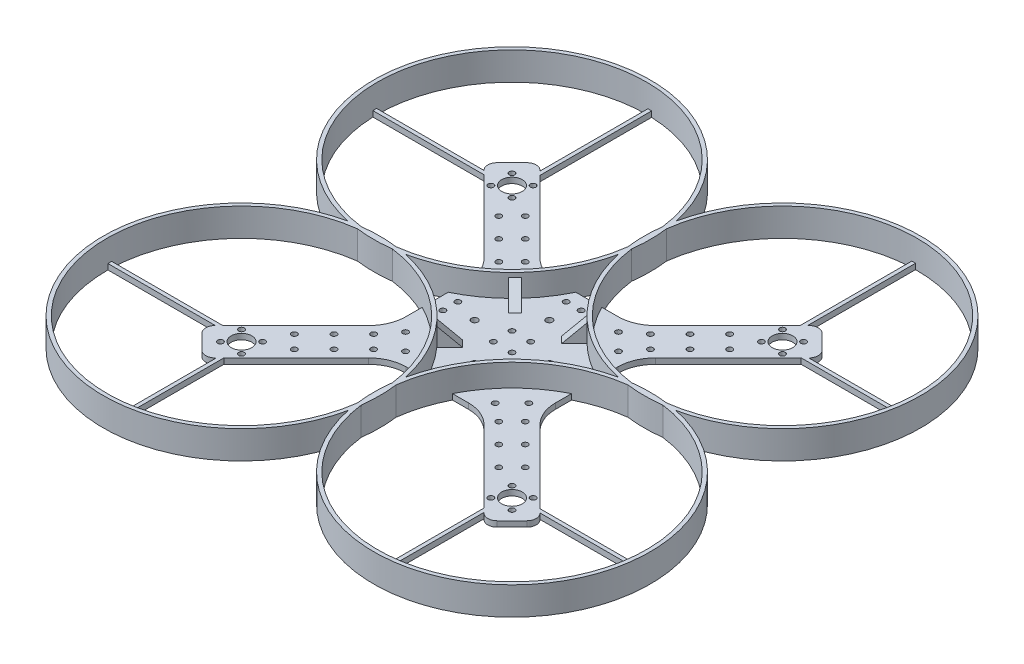
from build123d import *
from build123d.topology import SkipClean

# Parameters (mm, degrees)
BOSS_EXTRUDE1_DEPTH                          = 3
SKETCH2_R                                    = 5.5
CUT_EXTRUDE1_DEPTH                           = 126.093373509
SKETCH3_R                                    = 1.5
CUT_EXTRUDE2_DEPTH                           = 126.093373509
SKETCH4_R                                    = 74
SKETCH4_R_2                                  = 72
BOSS_EXTRUDE2_DEPTH                          = 15
SKETCH6_R                                    = 1.5
SKETCH6_R_2                                  = 1.75
CUT_EXTRUDE3_DEPTH                           = 208.379010802
SKETCH7_R                                    = 1.5
CUT_EXTRUDE4_DEPTH                           = 208.379010802
LPATTERN1_COUNT                              = 3
LPATTERN1_PITCH                              = 15
BOSS_EXTRUDE3_DEPTH                          = 10
SKETCH9_W                                    = 2
SKETCH9_H                                    = 62.719662137
SKETCH9_W_2                                  = 62.602149485
SKETCH9_H_2                                  = 2
BOSS_EXTRUDE4_DEPTH                          = 3
MIRROR2_COPY_1_SKETCH_R                      = 1.5
MIRROR2_COPY_1_DEPTH                         = 208.379010802
MIRROR2_COPY_2_SKETCH_R                      = 1.5
MIRROR2_COPY_2_DEPTH                         = 208.379010802
MIRROR2_AT_THE_SECOND_PLANE_COPY_1_SKETC_R   = 1.5
MIRROR2_AT_THE_SECOND_PLANE_COPY_1_DEPTH     = 208.379010802
MIRROR2_AT_THE_SECOND_PLANE_COPY_2_SKETC_R   = 1.5
MIRROR2_AT_THE_SECOND_PLANE_COPY_2_DEPTH     = 208.379010802
MIRROR2_AT_THE_SECOND_PLANE_COPY_3_DEPTH     = 3
MIRROR2_AT_THE_SECOND_PLANE_COPY_4_SKETC_R   = 5.5
MIRROR2_AT_THE_SECOND_PLANE_COPY_4_DEPTH     = 126.093373509
MIRROR2_AT_THE_SECOND_PLANE_COPY_5_SKETC_R   = 1.5
MIRROR2_AT_THE_SECOND_PLANE_COPY_5_DEPTH     = 126.093373509
MIRROR2_AT_THE_SECOND_PLANE_COPY_6_SKETC_R   = 74
MIRROR2_AT_THE_SECOND_PLANE_COPY_6_SKETC_R_2 = 72
MIRROR2_AT_THE_SECOND_PLANE_COPY_6_DEPTH     = 15
MIRROR2_AT_THE_SECOND_PLANE_COPY_7_SKETC_R   = 1.5
MIRROR2_AT_THE_SECOND_PLANE_COPY_7_SKETC_R_2 = 1.75
MIRROR2_AT_THE_SECOND_PLANE_COPY_7_DEPTH     = 208.379010802
MIRROR2_AT_THE_SECOND_PLANE_COPY_8_SKETC_R   = 1.5
MIRROR2_AT_THE_SECOND_PLANE_COPY_8_DEPTH     = 208.379010802
MIRROR2_AT_THE_SECOND_PLANE_COPY_9_DEPTH     = 10
MIRROR2_AT_THE_SECOND_PLANE_COPY_10_SKET_W   = 2
MIRROR2_AT_THE_SECOND_PLANE_COPY_10_SKET_H   = 62.719662137
MIRROR2_AT_THE_SECOND_PLANE_COPY_10_SKET_W_2 = 62.602149485
MIRROR2_AT_THE_SECOND_PLANE_COPY_10_SKET_H_2 = 2
MIRROR2_AT_THE_SECOND_PLANE_COPY_10_DEPTH    = 3
MIRROR2_AT_THE_SECOND_PLANE_COPY_11_SKET_R   = 1.5
MIRROR2_AT_THE_SECOND_PLANE_COPY_11_DEPTH    = 208.379010802
MIRROR2_AT_THE_SECOND_PLANE_COPY_12_SKET_R   = 1.5
MIRROR2_AT_THE_SECOND_PLANE_COPY_12_DEPTH    = 208.379010802
CHAMFER1_SIZE                                = 10


with BuildPart() as part:
    # Sketch1 → Boss-Extrude1 (new body)
    with BuildSketch(Plane(origin=(0, 0, 0), x_dir=(1, 0, 0), z_dir=(0, 1, 0))):
        with BuildLine():
            Line((30.857864376, 45.857864376), (71.964466094, 86.964466094))
            ThreePointArc((71.964466094, 86.964466094), (75.5, 88.428932188), (79.035533906, 86.964466094))
            Line((79.035533906, 86.964466094), (86.964466094, 79.035533906))
            ThreePointArc((86.964466094, 79.035533906), (88.428932188, 75.5), (86.964466094, 71.964466094))
            Line((86.964466094, 71.964466094), (45.857864376, 30.857864376))
            ThreePointArc((45.857864376, 30.857864376), (41.52240935, 24.3693974), (40, 16.715728753))
            Line((40, 16.715728753), (40, 0))
            Line((40, 0), (0, 0))
            Line((0, 0), (0, 40))
            Line((0, 40), (16.715728753, 40))
            ThreePointArc((16.715728753, 40), (24.3693974, 41.52240935), (30.857864376, 45.857864376))
        make_face()
    boss_extrude1 = extrude(amount=BOSS_EXTRUDE1_DEPTH)

    # Sketch2 → Cut-Extrude1 (cut, through all)
    with BuildSketch(Plane(origin=(0, 3, 0), x_dir=(1, 0, 0), z_dir=(0, 1, 0))):
        with Locations(Location((72.393398282, 72.393398282, 0), (0, 0, 270))):
            Circle(SKETCH2_R)
    cut_extrude1 = extrude(amount=-CUT_EXTRUDE1_DEPTH, mode=Mode.SUBTRACT)

    # Sketch3 → Cut-Extrude2 (cut, through all)
    with BuildSketch(Plane(origin=(0, 3, 0), x_dir=(1, 0, 0), z_dir=(0, 1, 0))):
        with Locations(Location((66.736544033, 78.050252532, 0), (0, 0, 270))):
            Circle(SKETCH3_R)
        with Locations(Location((66.736544033, 66.736544033, 0), (0, 0, 270))):
            Circle(SKETCH3_R)
        with Locations(Location((78.050252532, 66.736544033, 0), (0, 0, 270))):
            Circle(SKETCH3_R)
        with Locations(Location((78.050252532, 78.050252532, 0), (0, 0, 270))):
            Circle(SKETCH3_R)
    cut_extrude2 = extrude(amount=-CUT_EXTRUDE2_DEPTH, mode=Mode.SUBTRACT)

    # Sketch4 → Boss-Extrude2 (add)
    with BuildSketch(Plane(origin=(0, 0, 0), x_dir=(1, 0, 0), z_dir=(0, 1, 0))):
        with Locations(Location((72.393398282, 72.393398282, 0), (0, 0, 205.960322583))):
            Circle(SKETCH4_R)
        with Locations(Location((72.393398282, 72.393398282, 0), (0, 0, 206.737801334))):
            Circle(SKETCH4_R_2, mode=Mode.SUBTRACT)
    boss_extrude2 = extrude(amount=BOSS_EXTRUDE2_DEPTH)

    # Sketch6 → Cut-Extrude3 (cut, through all)
    with BuildSketch(Plane(origin=(0, 3, 0), x_dir=(1, 0, 0), z_dir=(0, 1, 0))):
        with Locations(Location((33, 24, 0), (0, 0, 270))):
            Circle(SKETCH6_R)
        with Locations(Location((24, 33, 0), (0, 0, 270))):
            Circle(SKETCH6_R)
        with Locations(Location((4, 33, 0), (0, 0, 270))):
            Circle(SKETCH6_R)
        with Locations(Location((33, 4, 0), (0, 0, 270))):
            Circle(SKETCH6_R)
        with Locations(Location((5, 5, 0), (0, 0, 270))):
            Circle(SKETCH6_R)
        with Locations((0, 20)):
            Circle(SKETCH6_R_2)
        with Locations((20, 0)):
            Circle(SKETCH6_R_2)
    cut_extrude3 = extrude(amount=-CUT_EXTRUDE3_DEPTH, mode=Mode.SUBTRACT)

    # Sketch7 → Cut-Extrude4 (cut, through all)
    with BuildSketch(Plane(origin=(0, 3, 0), x_dir=(1, 0, 0), z_dir=(0, 1, 0))):
        with Locations(Location((54.715728753, 61.786796564, 0), (0, 0, 270))):
            Circle(SKETCH7_R)
        with Locations(Location((61.786796564, 54.715728753, 0), (0, 0, 270))):
            Circle(SKETCH7_R)
    cut_extrude4 = extrude(amount=-CUT_EXTRUDE4_DEPTH, mode=Mode.SUBTRACT)

    # LPattern1: Cut-Extrude4 ×3
    with Locations(*[Vector(-0.707106781186546, 0, 0.707106781186549) * (i * LPATTERN1_PITCH) for i in range(1, LPATTERN1_COUNT)]):
        add(cut_extrude4, mode=Mode.SUBTRACT)

    # Sketch8 → Boss-Extrude3 (add)
    with BuildSketch(Plane(origin=(0, 3, 0), x_dir=(1, 0, 0), z_dir=(0, 1, 0))):
        Polygon((18.240443886, 23.420052459), (21.720624472, 19.939871873), (14.166877011, 12.386124412), (10.686696425, 15.866304998), align=None)
    boss_extrude3 = extrude(amount=BOSS_EXTRUDE3_DEPTH)

    # Sketch9 → Boss-Extrude4 (add)
    with BuildSketch(Plane(origin=(0, 0, 0), x_dir=(1, 0, 0), z_dir=(0, 1, 0))):
        with Locations((70.619821935, 113.693479817)):
            Rectangle(SKETCH9_W, SKETCH9_H)
        with Locations((113.743421737, 70.901552947)):
            Rectangle(SKETCH9_W_2, SKETCH9_H_2)
    boss_extrude4 = extrude(amount=BOSS_EXTRUDE4_DEPTH)

    # Mirror2: Boss-Extrude1, Cut-Extrude1, Cut-Extrude2, Boss-Extrude2, Cut-Extrude3, Cut-Extrude4, Boss-Extrude3, Boss-Extrude4 across plane
    with SkipClean():  # the faces are left unmerged after this step: merging them gives an invalid solid
        add(boss_extrude1.mirror(Plane(origin=(0, 0, 0), x_dir=(0, 0, 1), z_dir=(1, 0, 0))))
        add(cut_extrude1.mirror(Plane(origin=(0, 0, 0), x_dir=(0, 0, 1), z_dir=(1, 0, 0))), mode=Mode.SUBTRACT)
        add(cut_extrude2.mirror(Plane(origin=(0, 0, 0), x_dir=(0, 0, 1), z_dir=(1, 0, 0))), mode=Mode.SUBTRACT)
        add(boss_extrude2.mirror(Plane(origin=(0, 0, 0), x_dir=(0, 0, 1), z_dir=(1, 0, 0))))
        add(cut_extrude3.mirror(Plane(origin=(0, 0, 0), x_dir=(0, 0, 1), z_dir=(1, 0, 0))), mode=Mode.SUBTRACT)
        add(cut_extrude4.mirror(Plane(origin=(0, 0, 0), x_dir=(0, 0, 1), z_dir=(1, 0, 0))), mode=Mode.SUBTRACT)
        add(boss_extrude3.mirror(Plane(origin=(0, 0, 0), x_dir=(0, 0, 1), z_dir=(1, 0, 0))))
        add(boss_extrude4.mirror(Plane(origin=(0, 0, 0), x_dir=(0, 0, 1), z_dir=(1, 0, 0))))
    add(part.part.scale(1), mode=Mode.REPLACE)  # the faces are merged on a copy

    # Mirror2 copy 1 sketch → Mirror2 copy 1 (cut, through all)
    with BuildSketch(Plane(origin=(10.606601718, 3, 10.606601718), x_dir=(-1, 0, 0), z_dir=(0, 1, 0))):
        with Locations((54.715728753, -61.786796564)):
            Circle(MIRROR2_COPY_1_SKETCH_R)
        with Locations((61.786796564, -54.715728753)):
            Circle(MIRROR2_COPY_1_SKETCH_R)
    extrude(amount=-MIRROR2_COPY_1_DEPTH, mode=Mode.SUBTRACT)

    # Mirror2 copy 2 sketch → Mirror2 copy 2 (cut, through all)
    with BuildSketch(Plane(origin=(21.213203436, 3, 21.213203436), x_dir=(-1, 0, 0), z_dir=(0, 1, 0))):
        with Locations((54.715728753, -61.786796564)):
            Circle(MIRROR2_COPY_2_SKETCH_R)
        with Locations((61.786796564, -54.715728753)):
            Circle(MIRROR2_COPY_2_SKETCH_R)
    extrude(amount=-MIRROR2_COPY_2_DEPTH, mode=Mode.SUBTRACT)

    # Mirror2 at the second plane: Boss-Extrude1, Cut-Extrude1, Cut-Extrude2, Boss-Extrude2, Cut-Extrude3, Cut-Extrude4, Boss-Extrude3, Boss-Extrude4 across plane
    with SkipClean():  # the faces are left unmerged after this step: merging them gives an invalid solid
        add(boss_extrude1.mirror(Plane.XY))
        add(cut_extrude1.mirror(Plane.XY), mode=Mode.SUBTRACT)
        add(cut_extrude2.mirror(Plane.XY), mode=Mode.SUBTRACT)
        add(boss_extrude2.mirror(Plane.XY))
        add(cut_extrude3.mirror(Plane.XY), mode=Mode.SUBTRACT)
        add(cut_extrude4.mirror(Plane.XY), mode=Mode.SUBTRACT)
        add(boss_extrude3.mirror(Plane.XY))
        add(boss_extrude4.mirror(Plane.XY))
    add(part.part.scale(1), mode=Mode.REPLACE)  # the faces are merged on a copy

    # Mirror2 at the second plane copy 1 sketc → Mirror2 at the second plane copy 1 (cut, through all)
    with BuildSketch(Plane(origin=(-10.606601718, 3, -10.606601718), x_dir=(1, 0, 0), z_dir=(0, 1, 0))):
        with Locations((54.715728753, -61.786796564)):
            Circle(MIRROR2_AT_THE_SECOND_PLANE_COPY_1_SKETC_R)
        with Locations((61.786796564, -54.715728753)):
            Circle(MIRROR2_AT_THE_SECOND_PLANE_COPY_1_SKETC_R)
    extrude(amount=-MIRROR2_AT_THE_SECOND_PLANE_COPY_1_DEPTH, mode=Mode.SUBTRACT)

    # Mirror2 at the second plane copy 2 sketc → Mirror2 at the second plane copy 2 (cut, through all)
    with BuildSketch(Plane(origin=(-21.213203436, 3, -21.213203436), x_dir=(1, 0, 0), z_dir=(0, 1, 0))):
        with Locations((54.715728753, -61.786796564)):
            Circle(MIRROR2_AT_THE_SECOND_PLANE_COPY_2_SKETC_R)
        with Locations((61.786796564, -54.715728753)):
            Circle(MIRROR2_AT_THE_SECOND_PLANE_COPY_2_SKETC_R)
    extrude(amount=-MIRROR2_AT_THE_SECOND_PLANE_COPY_2_DEPTH, mode=Mode.SUBTRACT)

    # Mirror2 at the second plane copy 3 sketc → Mirror2 at the second plane copy 3 (add)
    with BuildSketch(Plane(origin=(0, 0, 0), x_dir=(-1, 0, 0), z_dir=(0, 1, 0))):
        with BuildLine():
            Line((30.857864376, 45.857864376), (71.964466094, 86.964466094))
            ThreePointArc((71.964466094, 86.964466094), (75.5, 88.428932188), (79.035533906, 86.964466094))
            Line((79.035533906, 86.964466094), (86.964466094, 79.035533906))
            ThreePointArc((86.964466094, 79.035533906), (88.428932188, 75.5), (86.964466094, 71.964466094))
            Line((86.964466094, 71.964466094), (45.857864376, 30.857864376))
            ThreePointArc((45.857864376, 30.857864376), (41.52240935, 24.3693974), (40, 16.715728753))
            Line((40, 16.715728753), (40, 0))
            Line((40, 0), (0, 0))
            Line((0, 0), (0, 40))
            Line((0, 40), (16.715728753, 40))
            ThreePointArc((16.715728753, 40), (24.3693974, 41.52240935), (30.857864376, 45.857864376))
        make_face()
    extrude(amount=MIRROR2_AT_THE_SECOND_PLANE_COPY_3_DEPTH)

    # Mirror2 at the second plane copy 4 sketc → Mirror2 at the second plane copy 4 (cut, through all)
    with BuildSketch(Plane(origin=(0, 3, 0), x_dir=(-1, 0, 0), z_dir=(0, 1, 0))):
        with Locations(Location((72.393398282, 72.393398282, 0), (0, 0, 270))):
            Circle(MIRROR2_AT_THE_SECOND_PLANE_COPY_4_SKETC_R)
    extrude(amount=-MIRROR2_AT_THE_SECOND_PLANE_COPY_4_DEPTH, mode=Mode.SUBTRACT)

    # Mirror2 at the second plane copy 5 sketc → Mirror2 at the second plane copy 5 (cut, through all)
    with BuildSketch(Plane(origin=(0, 3, 0), x_dir=(-1, 0, 0), z_dir=(0, 1, 0))):
        with Locations(Location((66.736544033, 78.050252532, 0), (0, 0, 270))):
            Circle(MIRROR2_AT_THE_SECOND_PLANE_COPY_5_SKETC_R)
        with Locations(Location((66.736544033, 66.736544033, 0), (0, 0, 270))):
            Circle(MIRROR2_AT_THE_SECOND_PLANE_COPY_5_SKETC_R)
        with Locations(Location((78.050252532, 66.736544033, 0), (0, 0, 270))):
            Circle(MIRROR2_AT_THE_SECOND_PLANE_COPY_5_SKETC_R)
        with Locations(Location((78.050252532, 78.050252532, 0), (0, 0, 270))):
            Circle(MIRROR2_AT_THE_SECOND_PLANE_COPY_5_SKETC_R)
    extrude(amount=-MIRROR2_AT_THE_SECOND_PLANE_COPY_5_DEPTH, mode=Mode.SUBTRACT)

    # Mirror2 at the second plane copy 6 sketc → Mirror2 at the second plane copy 6 (add)
    with SkipClean():  # the faces are left unmerged after this step: merging them gives an invalid solid
        with BuildSketch(Plane(origin=(0, 0, 0), x_dir=(-1, 0, 0), z_dir=(0, 1, 0))):
            with Locations(Location((72.393398282, 72.393398282, 0), (0, 0, 205.960322583))):
                Circle(MIRROR2_AT_THE_SECOND_PLANE_COPY_6_SKETC_R)
            with Locations(Location((72.393398282, 72.393398282, 0), (0, 0, 206.737801334))):
                Circle(MIRROR2_AT_THE_SECOND_PLANE_COPY_6_SKETC_R_2, mode=Mode.SUBTRACT)
        extrude(amount=MIRROR2_AT_THE_SECOND_PLANE_COPY_6_DEPTH)
    add(part.part.scale(1), mode=Mode.REPLACE)  # the faces are merged on a copy

    # Mirror2 at the second plane copy 7 sketc → Mirror2 at the second plane copy 7 (cut, through all)
    with SkipClean():  # the faces are left unmerged after this step: merging them gives an invalid solid
        with BuildSketch(Plane(origin=(0, 3, 0), x_dir=(-1, 0, 0), z_dir=(0, 1, 0))):
            with Locations(Location((33, 24, 0), (0, 0, 270))):
                Circle(MIRROR2_AT_THE_SECOND_PLANE_COPY_7_SKETC_R)
            with Locations(Location((24, 33, 0), (0, 0, 270))):
                Circle(MIRROR2_AT_THE_SECOND_PLANE_COPY_7_SKETC_R)
            with Locations(Location((4, 33, 0), (0, 0, 270))):
                Circle(MIRROR2_AT_THE_SECOND_PLANE_COPY_7_SKETC_R)
            with Locations(Location((33, 4, 0), (0, 0, 270))):
                Circle(MIRROR2_AT_THE_SECOND_PLANE_COPY_7_SKETC_R)
            with Locations(Location((5, 5, 0), (0, 0, 270))):
                Circle(MIRROR2_AT_THE_SECOND_PLANE_COPY_7_SKETC_R)
            with Locations((0, 20)):
                Circle(MIRROR2_AT_THE_SECOND_PLANE_COPY_7_SKETC_R_2)
            with Locations((20, 0)):
                Circle(MIRROR2_AT_THE_SECOND_PLANE_COPY_7_SKETC_R_2)
        extrude(amount=-MIRROR2_AT_THE_SECOND_PLANE_COPY_7_DEPTH, mode=Mode.SUBTRACT)

    # Mirror2 at the second plane copy 8 sketc → Mirror2 at the second plane copy 8 (cut, through all)
    with SkipClean():  # the faces are left unmerged after this step: merging them gives an invalid solid
        with BuildSketch(Plane(origin=(0, 3, 0), x_dir=(-1, 0, 0), z_dir=(0, 1, 0))):
            with Locations(Location((54.715728753, 61.786796564, 0), (0, 0, 270))):
                Circle(MIRROR2_AT_THE_SECOND_PLANE_COPY_8_SKETC_R)
            with Locations(Location((61.786796564, 54.715728753, 0), (0, 0, 270))):
                Circle(MIRROR2_AT_THE_SECOND_PLANE_COPY_8_SKETC_R)
        extrude(amount=-MIRROR2_AT_THE_SECOND_PLANE_COPY_8_DEPTH, mode=Mode.SUBTRACT)

    # Mirror2 at the second plane copy 9 sketc → Mirror2 at the second plane copy 9 (add)
    with SkipClean():  # the faces are left unmerged after this step: merging them gives an invalid solid
        with BuildSketch(Plane(origin=(0, 3, 0), x_dir=(-1, 0, 0), z_dir=(0, 1, 0))):
            Polygon((18.240443886, 23.420052459), (21.720624472, 19.939871873), (14.166877011, 12.386124412), (10.686696425, 15.866304998), align=None)
        extrude(amount=MIRROR2_AT_THE_SECOND_PLANE_COPY_9_DEPTH)

    # Mirror2 at the second plane copy 10 sket → Mirror2 at the second plane copy 10 (add)
    with SkipClean():  # the faces are left unmerged after this step: merging them gives an invalid solid
        with BuildSketch(Plane(origin=(0, 0, 0), x_dir=(-1, 0, 0), z_dir=(0, 1, 0))):
            with Locations((70.619821935, 113.693479817)):
                Rectangle(MIRROR2_AT_THE_SECOND_PLANE_COPY_10_SKET_W, MIRROR2_AT_THE_SECOND_PLANE_COPY_10_SKET_H)
            with Locations((113.743421737, 70.901552947)):
                Rectangle(MIRROR2_AT_THE_SECOND_PLANE_COPY_10_SKET_W_2, MIRROR2_AT_THE_SECOND_PLANE_COPY_10_SKET_H_2)
        extrude(amount=MIRROR2_AT_THE_SECOND_PLANE_COPY_10_DEPTH)

    # Mirror2 at the second plane copy 11 sket → Mirror2 at the second plane copy 11 (cut, through all)
    with SkipClean():  # the faces are left unmerged after this step: merging them gives an invalid solid
        with BuildSketch(Plane(origin=(10.606601718, 3, -10.606601718), x_dir=(-1, 0, 0), z_dir=(0, 1, 0))):
            with Locations(Location((54.715728753, 61.786796564, 0), (0, 0, 270))):
                Circle(MIRROR2_AT_THE_SECOND_PLANE_COPY_11_SKET_R)
            with Locations(Location((61.786796564, 54.715728753, 0), (0, 0, 270))):
                Circle(MIRROR2_AT_THE_SECOND_PLANE_COPY_11_SKET_R)
        extrude(amount=-MIRROR2_AT_THE_SECOND_PLANE_COPY_11_DEPTH, mode=Mode.SUBTRACT)

    # Mirror2 at the second plane copy 12 sket → Mirror2 at the second plane copy 12 (cut, through all)
    with SkipClean():  # the faces are left unmerged after this step: merging them gives an invalid solid
        with BuildSketch(Plane(origin=(21.213203436, 3, -21.213203436), x_dir=(-1, 0, 0), z_dir=(0, 1, 0))):
            with Locations(Location((54.715728753, 61.786796564, 0), (0, 0, 270))):
                Circle(MIRROR2_AT_THE_SECOND_PLANE_COPY_12_SKET_R)
            with Locations(Location((61.786796564, 54.715728753, 0), (0, 0, 270))):
                Circle(MIRROR2_AT_THE_SECOND_PLANE_COPY_12_SKET_R)
        extrude(amount=-MIRROR2_AT_THE_SECOND_PLANE_COPY_12_DEPTH, mode=Mode.SUBTRACT)

    # Chamfer1
    # the kernel refuses this chamfer: 10 mm, written as the material it takes off along each edge
    with BuildSketch(Plane(origin=(32.35142181, 13, 5.798420387), x_dir=(0.7068394360706738, 0.027495876610586313, -0.7068394360706733), z_dir=(-0.7071067811865474, 0, -0.7071067811865477))) as chamfer1_piece_1_section:
        Polygon((CHAMFER1_SIZE * 0.999621916911, CHAMFER1_SIZE * 0.0274958766106), (-CHAMFER1_SIZE * 0.0274958766106, CHAMFER1_SIZE * 0.999621916911), (0, 0), align=None)
    chamfer1_piece_1 = extrude(amount=56.355378344, mode=Mode.PRIVATE)
    chamfer1_piece_1 = chamfer1_piece_1 - Plane(origin=(72.393398282, 9.709058725, -72.393398282), x_dir=(-0.8990974034681367, 0, 0.43774862544256443), z_dir=(0, -1, 0)) * Cylinder(74, 153, mode=Mode.PRIVATE)
    chamfer1_piece_1 = split(chamfer1_piece_1, bisect_by=Plane(origin=(14.755784183, 3, -16.457452714), z_dir=(0, 1, 0)), keep=Keep.TOP, mode=Mode.PRIVATE)
    add(chamfer1_piece_1, mode=Mode.SUBTRACT)
    with BuildSketch(Plane(origin=(32.35142181, 13, -5.798420387), x_dir=(0.7068394360706738, 0.027495876610586313, 0.7068394360706733), z_dir=(-0.7071067811865474, 0, 0.7071067811865477))) as chamfer1_piece_2_section:
        Polygon((CHAMFER1_SIZE * 0.999621916911, -CHAMFER1_SIZE * 0.0274958766106), (-CHAMFER1_SIZE * 0.0274958766106, -CHAMFER1_SIZE * 0.999621916911), (0, 0), align=None)
    chamfer1_piece_2 = extrude(amount=56.355378344, mode=Mode.PRIVATE)
    chamfer1_piece_2 = chamfer1_piece_2 - Plane(origin=(72.393398282, 9.709058725, 72.393398282), x_dir=(-0.8990974034681367, 0, -0.43774862544256443), z_dir=(0, -1, 0)) * Cylinder(74, 153, mode=Mode.PRIVATE)
    chamfer1_piece_2 = split(chamfer1_piece_2, bisect_by=Plane(origin=(14.755784183, 3, 16.457452714), z_dir=(0, 1, 0)), keep=Keep.TOP, mode=Mode.PRIVATE)
    add(chamfer1_piece_2, mode=Mode.SUBTRACT)
    with BuildSketch(Plane(origin=(-32.35142181, 13, 5.798420387), x_dir=(-0.7068394360706738, 0.027495876610586313, -0.7068394360706733), z_dir=(0.7071067811865474, 0, -0.7071067811865477))) as chamfer1_piece_3_section:
        Polygon((CHAMFER1_SIZE * 0.999621916911, -CHAMFER1_SIZE * 0.0274958766106), (-CHAMFER1_SIZE * 0.0274958766106, -CHAMFER1_SIZE * 0.999621916911), (0, 0), align=None)
    chamfer1_piece_3 = extrude(amount=56.355378344, mode=Mode.PRIVATE)
    chamfer1_piece_3 = chamfer1_piece_3 - Plane(origin=(-72.393398282, 9.709058725, -72.393398282), x_dir=(0.8990974034681367, 0, 0.43774862544256443), z_dir=(0, -1, 0)) * Cylinder(74, 153, mode=Mode.PRIVATE)
    chamfer1_piece_3 = split(chamfer1_piece_3, bisect_by=Plane(origin=(-14.755784183, 3, -16.457452714), z_dir=(0, 1, 0)), keep=Keep.TOP, mode=Mode.PRIVATE)
    add(chamfer1_piece_3, mode=Mode.SUBTRACT)
    with BuildSketch(Plane(origin=(-32.35142181, 13, -5.798420387), x_dir=(-0.7068394360706738, 0.027495876610586313, 0.7068394360706733), z_dir=(0.7071067811865474, 0, 0.7071067811865477))) as chamfer1_piece_4_section:
        Polygon((CHAMFER1_SIZE * 0.999621916911, CHAMFER1_SIZE * 0.0274958766106), (-CHAMFER1_SIZE * 0.0274958766106, CHAMFER1_SIZE * 0.999621916911), (0, 0), align=None)
    chamfer1_piece_4 = extrude(amount=56.355378344, mode=Mode.PRIVATE)
    chamfer1_piece_4 = chamfer1_piece_4 - Plane(origin=(-72.393398282, 9.709058725, 72.393398282), x_dir=(0.8990974034681367, 0, -0.43774862544256443), z_dir=(0, -1, 0)) * Cylinder(74, 153, mode=Mode.PRIVATE)
    chamfer1_piece_4 = split(chamfer1_piece_4, bisect_by=Plane(origin=(-14.755784183, 3, 16.457452714), z_dir=(0, 1, 0)), keep=Keep.TOP, mode=Mode.PRIVATE)
    add(chamfer1_piece_4, mode=Mode.SUBTRACT)


solid = part.part
